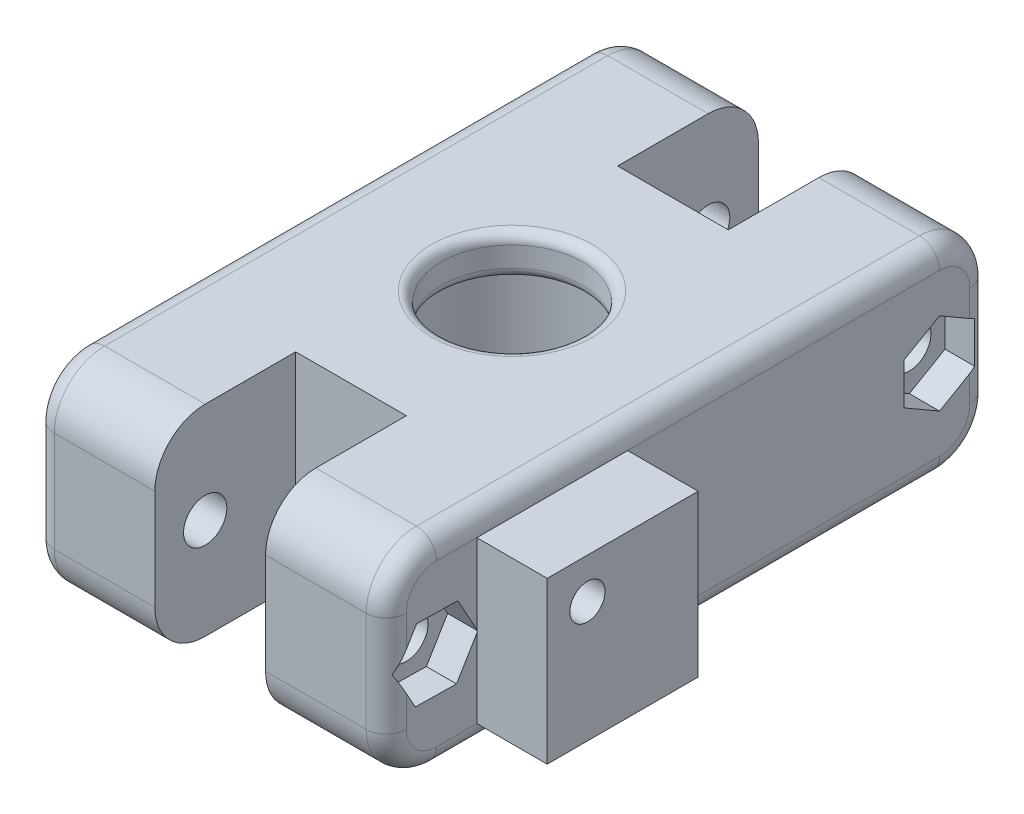
from build123d import *

# Parameters (mm, degrees)
SKETCH1_W           = 35
SKETCH1_H           = 60
BOSS_EXTRUDE1_DEPTH = 20
SKETCH2_R           = 10
CUT_EXTRUDE1_DEPTH  = 16
SKETCH4_R           = 7
CUT_EXTRUDE2_DEPTH  = 42.997755111
FILLET1_R           = 2
SKETCH5_W           = 11
SKETCH5_H           = 14
CUT_EXTRUDE3_DEPTH  = 44.678500826
SKETCH6_R           = 2.15
CUT_EXTRUDE4_DEPTH  = 53.234749007
FILLET3_R           = 5
FILLET4_R           = 5
FILLET7_R           = 1
SKETCH9_W           = 15
SKETCH9_H           = 16
BOSS_EXTRUDE3_DEPTH = 7
SKETCH10_R          = 1.75
CUT_EXTRUDE6_DEPTH  = 5
SKETCH12_R          = 3.6
CUT_EXTRUDE7_DEPTH  = 4
CUT_EXTRUDE8_DEPTH  = 3


with BuildPart() as part:
    # Sketch1 → Boss-Extrude1 (new body)
    with BuildSketch(Plane(origin=(0, 0, 0), x_dir=(1, 0, 0), z_dir=(0, 1, 0))):
        with Locations((-2.608267717, 3.218503937)):
            Rectangle(SKETCH1_W, SKETCH1_H)
    extrude(amount=BOSS_EXTRUDE1_DEPTH)

    # Sketch2 → Cut-Extrude1 (cut)
    with BuildSketch(Plane.XZ):
        with Locations(Location((-2.608267717, -3.218503937, 0), (0, 0, 270))):
            Circle(SKETCH2_R)
    extrude(amount=-CUT_EXTRUDE1_DEPTH, mode=Mode.SUBTRACT)

    # Sketch4 → Cut-Extrude2 (cut, through all)
    with BuildSketch(Plane.XZ.offset(-16)):
        with Locations(Location((-2.608267717, -3.218503937, 0), (0, 0, 270))):
            Circle(SKETCH4_R)
    extrude(amount=-CUT_EXTRUDE2_DEPTH, mode=Mode.SUBTRACT)

    # Fillet1
    fillet1_edges = [part.edges().sort_by_distance(p)[0] for p in [
        (-20.108267717, 20, -3.218503937),
        (14.891732283, 20, -3.218503937),
        (-20.108267717, 0, -3.218503937),
        (14.891732283, 0, -3.218503937),
        (14.891732283, 10, 26.781496063),
        (-20.108267717, 10, 26.781496063),
        (-20.108267717, 10, -33.218503937),
        (14.891732283, 10, -33.218503937),
    ]]
    fillet(fillet1_edges, radius=FILLET1_R)

    # Sketch5 → Cut-Extrude3 (cut, through all)
    with BuildSketch(Plane.XZ):
        with Locations((-2.608267717, 19.781496063)):
            Rectangle(SKETCH5_W, SKETCH5_H)
        with Locations((-2.608267717, -26.218503937)):
            Rectangle(SKETCH5_W, SKETCH5_H)
    extrude(amount=-CUT_EXTRUDE3_DEPTH, mode=Mode.SUBTRACT)

    # Sketch6 → Cut-Extrude4 (cut, through all)
    with BuildSketch(Plane.ZY.offset(20.108267717)):
        with Locations((-28.218503937, 10)):
            Circle(SKETCH6_R)
        with Locations((21.781496063, 10)):
            Circle(SKETCH6_R)
    extrude(amount=-CUT_EXTRUDE4_DEPTH, mode=Mode.SUBTRACT)

    # Fillet3
    # the kernel refuses this fillet: 5 mm, written as the material it takes off along each edge
    with BuildSketch(Plane(origin=(-20.108267717, 15, 21.781496063), x_dir=(0, 0, 1), z_dir=(0, -1, 0))) as fillet3_piece_1:
        with BuildLine():
            CenterArc((3, -2), 2, 0, 90)
            Line((5, -2), (5, 0))
            Line((5, 0), (3, 0))
        make_face()
    revolve(axis=Axis((-20.108267717, 15, 21.781496063), (-1, 0, 0)), revolution_arc=90, mode=Mode.SUBTRACT)
    with BuildSketch(Plane(origin=(-20.108267717, 5, 21.781496063), x_dir=(0, -1, 0), z_dir=(0, 0, -1))) as fillet3_piece_2:
        with BuildLine():
            CenterArc((3, -2), 2, 0, 90)
            Line((5, -2), (5, 0))
            Line((5, 0), (3, 0))
        make_face()
    revolve(axis=Axis((-20.108267717, 5, 21.781496063), (-1, 0, 0)), revolution_arc=90, mode=Mode.SUBTRACT)
    with BuildSketch(Plane(origin=(14.891732283, 15, 21.781496063), x_dir=(0, 1, 0), z_dir=(0, 0, -1))) as fillet3_piece_3:
        with BuildLine():
            CenterArc((3, -2), 2, 0, 90)
            Line((5, -2), (5, 0))
            Line((5, 0), (3, 0))
        make_face()
    revolve(axis=Axis((14.891732283, 15, 21.781496063), (1, 0, 0)), revolution_arc=90, mode=Mode.SUBTRACT)
    with BuildSketch(Plane(origin=(14.891732283, 5, 21.781496063), x_dir=(0, 0, 1), z_dir=(0, 1, 0))) as fillet3_piece_4:
        with BuildLine():
            CenterArc((3, -2), 2, 0, 90)
            Line((5, -2), (5, 0))
            Line((5, 0), (3, 0))
        make_face()
    revolve(axis=Axis((14.891732283, 5, 21.781496063), (1, 0, 0)), revolution_arc=90, mode=Mode.SUBTRACT)
    with BuildSketch(Plane(origin=(4.391732283, 20, 26.781496063), x_dir=(0, 0, -1), z_dir=(-1, 0, 0)), Plane(origin=(14.891732283, 0, 26.781496063), x_dir=(0, 1, 0), z_dir=(-1, 0, 0))) as fillet3_piece_5:
        with BuildLine():
            CenterArc((FILLET3_R, FILLET3_R), FILLET3_R, 180, 90)
            Line((0, FILLET3_R), (0, 0))
            Line((0, 0), (FILLET3_R, 0))
        make_face()
    extrude(amount=24.5, mode=Mode.SUBTRACT)
    with BuildSketch(Plane(origin=(4.391732283, 0, 26.781496063), x_dir=(0, 0, -1), z_dir=(-1, 0, 0)), Plane(origin=(14.891732283, 20, 26.781496063), x_dir=(0, -1, 0), z_dir=(-1, 0, 0))) as fillet3_piece_6:
        with BuildLine():
            CenterArc((FILLET3_R, -FILLET3_R), FILLET3_R, 90, 90)
            Line((0, -FILLET3_R), (0, 0))
            Line((0, 0), (FILLET3_R, 0))
        make_face()
    extrude(amount=24.5, mode=Mode.SUBTRACT)

    # Fillet4
    # the kernel refuses this fillet: 5 mm, written as the material it takes off along each edge
    with BuildSketch(Plane(origin=(-20.108267717, 15, -28.218503937), x_dir=(0, 1, 0), z_dir=(0, 0, 1))) as fillet4_piece_1:
        with BuildLine():
            CenterArc((3, -2), 2, 0, 90)
            Line((5, -2), (5, 0))
            Line((5, 0), (3, 0))
        make_face()
    revolve(axis=Axis((-20.108267717, 15, -28.218503937), (-1, 0, 0)), revolution_arc=90, mode=Mode.SUBTRACT)
    with BuildSketch(Plane(origin=(-20.108267717, 5, -28.218503937), x_dir=(0, 0, -1), z_dir=(0, 1, 0))) as fillet4_piece_2:
        with BuildLine():
            CenterArc((3, -2), 2, 0, 90)
            Line((5, -2), (5, 0))
            Line((5, 0), (3, 0))
        make_face()
    revolve(axis=Axis((-20.108267717, 5, -28.218503937), (-1, 0, 0)), revolution_arc=90, mode=Mode.SUBTRACT)
    with BuildSketch(Plane(origin=(14.891732283, 15, -28.218503937), x_dir=(0, 0, -1), z_dir=(0, -1, 0))) as fillet4_piece_3:
        with BuildLine():
            CenterArc((3, -2), 2, 0, 90)
            Line((5, -2), (5, 0))
            Line((5, 0), (3, 0))
        make_face()
    revolve(axis=Axis((14.891732283, 15, -28.218503937), (1, 0, 0)), revolution_arc=90, mode=Mode.SUBTRACT)
    with BuildSketch(Plane(origin=(14.891732283, 5, -28.218503937), x_dir=(0, -1, 0), z_dir=(0, 0, 1))) as fillet4_piece_4:
        with BuildLine():
            CenterArc((3, -2), 2, 0, 90)
            Line((5, -2), (5, 0))
            Line((5, 0), (3, 0))
        make_face()
    revolve(axis=Axis((14.891732283, 5, -28.218503937), (1, 0, 0)), revolution_arc=90, mode=Mode.SUBTRACT)
    with BuildSketch(Plane(origin=(-9.608267717, 0, -33.218503937), x_dir=(0, 1, 0), z_dir=(1, 0, 0)), Plane(origin=(-20.108267717, 0, -33.218503937), x_dir=(0, 1, 0), z_dir=(1, 0, 0))) as fillet4_piece_5:
        with BuildLine():
            CenterArc((FILLET4_R, FILLET4_R), FILLET4_R, 180, 90)
            Line((0, FILLET4_R), (0, 0))
            Line((0, 0), (FILLET4_R, 0))
        make_face()
    extrude(amount=24.5, mode=Mode.SUBTRACT)
    with BuildSketch(Plane(origin=(-9.608267717, 20, -33.218503937), x_dir=(0, -1, 0), z_dir=(1, 0, 0)), Plane(origin=(-20.108267717, 20, -33.218503937), x_dir=(0, -1, 0), z_dir=(1, 0, 0))) as fillet4_piece_6:
        with BuildLine():
            CenterArc((FILLET4_R, -FILLET4_R), FILLET4_R, 90, 90)
            Line((0, -FILLET4_R), (0, 0))
            Line((0, 0), (FILLET4_R, 0))
        make_face()
    extrude(amount=24.5, mode=Mode.SUBTRACT)

    # Fillet7
    fillet7_edges = [part.edges().sort_by_distance(p)[0] for p in [
        (-2.608267717, 20, 3.781496063),
        (-2.608267717, 16, 3.781496063),
    ]]
    fillet(fillet7_edges, radius=FILLET7_R)

    # Sketch9 → Boss-Extrude3 (add)
    with BuildSketch(Plane(origin=(14.891732283, 0, 0), x_dir=(0, 0, -1), z_dir=(1, 0, 0))):
        with Locations((-10.281496063, 10)):
            Rectangle(SKETCH9_W, SKETCH9_H)
    extrude(amount=BOSS_EXTRUDE3_DEPTH)

    # Sketch10 → Cut-Extrude6 (cut)
    with BuildSketch(Plane(origin=(21.891732283, 0, 0), x_dir=(0, 0, -1), z_dir=(1, 0, 0))):
        with Locations((-13.781496063, 14)):
            Circle(SKETCH10_R)
    extrude(amount=-CUT_EXTRUDE6_DEPTH, mode=Mode.SUBTRACT)

    # Sketch12 → Cut-Extrude7 (cut)
    with BuildSketch(Plane.ZY.offset(20.108267717)):
        with Locations((-28.218503937, 10)):
            Circle(SKETCH12_R)
        with Locations((21.781496063, 10)):
            Circle(SKETCH12_R)
    extrude(amount=-CUT_EXTRUDE7_DEPTH, mode=Mode.SUBTRACT)

    # Sketch13 → Cut-Extrude8 (cut)
    with BuildSketch(Plane(origin=(14.891732283, 0, 0), x_dir=(0, 0, -1), z_dir=(1, 0, 0))):
        Polygon((-19.793991712, 6.414869628), (-17.682929909, 9.928664072), (-19.67043426, 13.513794445), (-23.769000414, 13.585130372), (-25.880062217, 10.071335928), (-23.892557866, 6.486205555), align=None)
        Polygon((28.218503937, 5.900813089), (31.768503937, 7.950406544), (31.768503937, 12.049593456), (28.218503937, 14.099186911), (24.668503937, 12.049593456), (24.668503937, 7.950406544), align=None)
    extrude(amount=-CUT_EXTRUDE8_DEPTH, mode=Mode.SUBTRACT)


solid = part.part
